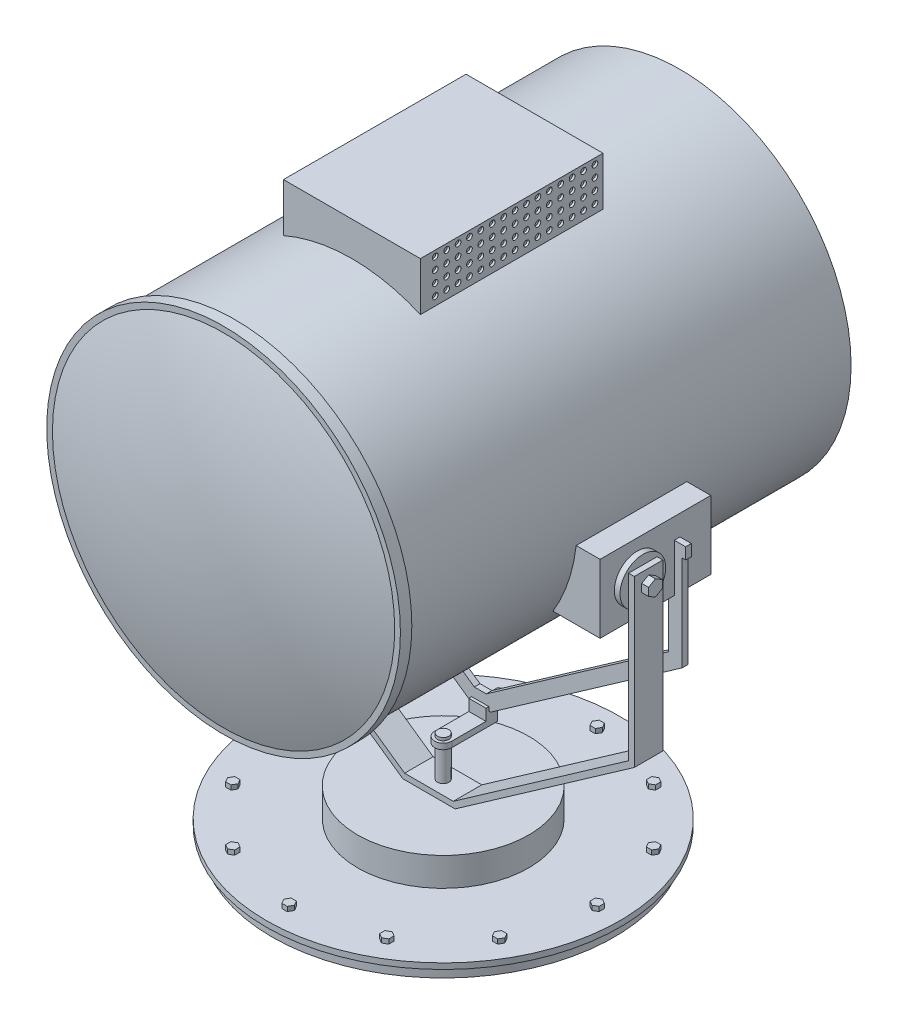
from build123d import *

# Parameters (mm, degrees)
SKETCH1_R                        = 150
BOSS_EXTRUDE1_DEPTH              = 10
SKETCH2_R                        = 155
BOSS_EXTRUDE2_DEPTH              = 5
SKETCH3_R                        = 75
BOSS_EXTRUDE3_DEPTH              = 25
BOSS_EXTRUDE4_DEPTH              = 12.5
SKETCH5_W                        = 5
SKETCH5_H                        = 25
BOSS_EXTRUDE5_DEPTH              = 80
SKETCH6_R                        = 150
BOSS_EXTRUDE6_DEPTH              = 207.5
SKETCH7_R                        = 150
CUT_EXTRUDE1_DEPTH               = 15
SKETCH9_R                        = 155
SKETCH9_R_2                      = 150
BOSS_EXTRUDE8_DEPTH              = 10
BOSS_EXTRUDE9_REACH              = 559.388
BOSS_EXTRUDE9_END_RADIUS         = 150
SKETCH10_W                       = 120
SKETCH10_H                       = 160
BOSS_EXTRUDE9_DIRECTION_2_DEPTH  = 25
SKETCH11_R                       = 20
BOSS_EXTRUDE10_DEPTH             = 5
BOSS_EXTRUDE11_REACH             = 654.423
BOSS_EXTRUDE11_END_RADIUS        = 150
SKETCH12_W                       = 65
SKETCH12_H                       = 60
BOSS_EXTRUDE12_REACH             = 435.222
BOSS_EXTRUDE12_END_RADIUS        = 150
SKETCH13_W                       = 80
SKETCH13_H                       = 240
BOSS_EXTRUDE12_DIRECTION_2_DEPTH = 8
SKETCH14_R                       = 2.5
CUT_EXTRUDE2_DEPTH               = 2
BOSS_EXTRUDE13_DEPTH             = 32
LPATTERN1_COUNT                  = 15
LPATTERN1_PITCH                  = 10
LPATTERN1_COUNT_DIR2             = 4
LPATTERN1_PITCH_DIR2             = 10
SKETCH16_R                       = 2.5
CUT_EXTRUDE3_DEPTH               = 5
LPATTERN2_COUNT                  = 23
LPATTERN2_PITCH                  = 10
MIRROR2_COPY_1_SKETCH_R          = 2.5
MIRROR2_COPY_1_DEPTH             = 2
MIRROR2_COPY_2_SKETCH_R          = 2.5
MIRROR2_COPY_2_DEPTH             = 2
MIRROR2_COPY_3_SKETCH_R          = 2.5
MIRROR2_COPY_3_DEPTH             = 2
MIRROR2_COPY_4_SKETCH_R          = 2.5
MIRROR2_COPY_4_DEPTH             = 2
MIRROR2_COPY_5_SKETCH_R          = 2.5
MIRROR2_COPY_5_DEPTH             = 2
MIRROR2_COPY_6_SKETCH_R          = 2.5
MIRROR2_COPY_6_DEPTH             = 2
MIRROR2_COPY_7_SKETCH_R          = 2.5
MIRROR2_COPY_7_DEPTH             = 2
MIRROR2_COPY_8_SKETCH_R          = 2.5
MIRROR2_COPY_8_DEPTH             = 2
MIRROR2_COPY_9_SKETCH_R          = 2.5
MIRROR2_COPY_9_DEPTH             = 2
MIRROR2_COPY_10_SKETCH_R         = 2.5
MIRROR2_COPY_10_DEPTH            = 2
MIRROR2_COPY_11_SKETCH_R         = 2.5
MIRROR2_COPY_11_DEPTH            = 2
MIRROR2_COPY_12_SKETCH_R         = 2.5
MIRROR2_COPY_12_DEPTH            = 2
MIRROR2_COPY_13_SKETCH_R         = 2.5
MIRROR2_COPY_13_DEPTH            = 2
MIRROR2_COPY_14_SKETCH_R         = 2.5
MIRROR2_COPY_14_DEPTH            = 2
MIRROR2_COPY_15_SKETCH_R         = 2.5
MIRROR2_COPY_15_DEPTH            = 2
MIRROR2_COPY_16_SKETCH_R         = 2.5
MIRROR2_COPY_16_DEPTH            = 2
MIRROR2_COPY_17_SKETCH_R         = 2.5
MIRROR2_COPY_17_DEPTH            = 2
MIRROR2_COPY_18_SKETCH_R         = 2.5
MIRROR2_COPY_18_DEPTH            = 2
MIRROR2_COPY_19_SKETCH_R         = 2.5
MIRROR2_COPY_19_DEPTH            = 2
MIRROR2_COPY_20_SKETCH_R         = 2.5
MIRROR2_COPY_20_DEPTH            = 2
MIRROR2_COPY_21_SKETCH_R         = 2.5
MIRROR2_COPY_21_DEPTH            = 2
MIRROR2_COPY_22_SKETCH_R         = 2.5
MIRROR2_COPY_22_DEPTH            = 2
MIRROR2_COPY_23_SKETCH_R         = 2.5
MIRROR2_COPY_23_DEPTH            = 2
MIRROR2_COPY_24_SKETCH_R         = 2.5
MIRROR2_COPY_24_DEPTH            = 2
MIRROR2_COPY_25_SKETCH_R         = 2.5
MIRROR2_COPY_25_DEPTH            = 2
MIRROR2_COPY_26_SKETCH_R         = 2.5
MIRROR2_COPY_26_DEPTH            = 2
MIRROR2_COPY_27_SKETCH_R         = 2.5
MIRROR2_COPY_27_DEPTH            = 2
MIRROR2_COPY_28_SKETCH_R         = 2.5
MIRROR2_COPY_28_DEPTH            = 2
MIRROR2_COPY_29_SKETCH_R         = 2.5
MIRROR2_COPY_29_DEPTH            = 2
MIRROR2_COPY_30_SKETCH_R         = 2.5
MIRROR2_COPY_30_DEPTH            = 2
MIRROR2_COPY_31_SKETCH_R         = 2.5
MIRROR2_COPY_31_DEPTH            = 2
MIRROR2_COPY_32_SKETCH_R         = 2.5
MIRROR2_COPY_32_DEPTH            = 2
MIRROR2_COPY_33_SKETCH_R         = 2.5
MIRROR2_COPY_33_DEPTH            = 2
MIRROR2_COPY_34_SKETCH_R         = 2.5
MIRROR2_COPY_34_DEPTH            = 2
MIRROR2_COPY_35_SKETCH_R         = 2.5
MIRROR2_COPY_35_DEPTH            = 2
MIRROR2_COPY_36_SKETCH_R         = 2.5
MIRROR2_COPY_36_DEPTH            = 2
MIRROR2_COPY_37_SKETCH_R         = 2.5
MIRROR2_COPY_37_DEPTH            = 2
MIRROR2_COPY_38_SKETCH_R         = 2.5
MIRROR2_COPY_38_DEPTH            = 2
MIRROR2_COPY_39_SKETCH_R         = 2.5
MIRROR2_COPY_39_DEPTH            = 2
MIRROR2_COPY_40_SKETCH_R         = 2.5
MIRROR2_COPY_40_DEPTH            = 2
MIRROR2_COPY_41_SKETCH_R         = 2.5
MIRROR2_COPY_41_DEPTH            = 2
MIRROR2_COPY_42_SKETCH_R         = 2.5
MIRROR2_COPY_42_DEPTH            = 2
MIRROR2_COPY_43_SKETCH_R         = 2.5
MIRROR2_COPY_43_DEPTH            = 2
MIRROR2_COPY_44_SKETCH_R         = 2.5
MIRROR2_COPY_44_DEPTH            = 2
MIRROR2_COPY_45_SKETCH_R         = 2.5
MIRROR2_COPY_45_DEPTH            = 2
MIRROR2_COPY_46_SKETCH_R         = 2.5
MIRROR2_COPY_46_DEPTH            = 2
MIRROR2_COPY_47_SKETCH_R         = 2.5
MIRROR2_COPY_47_DEPTH            = 2
MIRROR2_COPY_48_SKETCH_R         = 2.5
MIRROR2_COPY_48_DEPTH            = 2
MIRROR2_COPY_49_SKETCH_R         = 2.5
MIRROR2_COPY_49_DEPTH            = 2
MIRROR2_COPY_50_SKETCH_R         = 2.5
MIRROR2_COPY_50_DEPTH            = 2
MIRROR2_COPY_51_SKETCH_R         = 2.5
MIRROR2_COPY_51_DEPTH            = 2
MIRROR2_COPY_52_SKETCH_R         = 2.5
MIRROR2_COPY_52_DEPTH            = 2
MIRROR2_COPY_53_SKETCH_R         = 2.5
MIRROR2_COPY_53_DEPTH            = 2
MIRROR2_COPY_54_SKETCH_R         = 2.5
MIRROR2_COPY_54_DEPTH            = 2
MIRROR2_COPY_55_SKETCH_R         = 2.5
MIRROR2_COPY_55_DEPTH            = 2
MIRROR2_COPY_56_SKETCH_R         = 2.5
MIRROR2_COPY_56_DEPTH            = 2
MIRROR2_COPY_57_SKETCH_R         = 2.5
MIRROR2_COPY_57_DEPTH            = 2
MIRROR2_COPY_58_SKETCH_R         = 2.5
MIRROR2_COPY_58_DEPTH            = 2
MIRROR2_COPY_59_SKETCH_R         = 2.5
MIRROR2_COPY_59_DEPTH            = 2
MIRROR2_COPY_60_SKETCH_R         = 2.5
MIRROR2_COPY_60_DEPTH            = 5
MIRROR2_COPY_61_SKETCH_R         = 2.5
MIRROR2_COPY_61_DEPTH            = 5
MIRROR2_COPY_62_SKETCH_R         = 2.5
MIRROR2_COPY_62_DEPTH            = 5
MIRROR2_COPY_63_SKETCH_R         = 2.5
MIRROR2_COPY_63_DEPTH            = 5
MIRROR2_COPY_64_SKETCH_R         = 2.5
MIRROR2_COPY_64_DEPTH            = 5
MIRROR2_COPY_65_SKETCH_R         = 2.5
MIRROR2_COPY_65_DEPTH            = 5
MIRROR2_COPY_66_SKETCH_R         = 2.5
MIRROR2_COPY_66_DEPTH            = 5
MIRROR2_COPY_67_SKETCH_R         = 2.5
MIRROR2_COPY_67_DEPTH            = 5
MIRROR2_COPY_68_SKETCH_R         = 2.5
MIRROR2_COPY_68_DEPTH            = 5
MIRROR2_COPY_69_SKETCH_R         = 2.5
MIRROR2_COPY_69_DEPTH            = 5
MIRROR2_COPY_70_SKETCH_R         = 2.5
MIRROR2_COPY_70_DEPTH            = 5
MIRROR2_COPY_71_SKETCH_R         = 2.5
MIRROR2_COPY_71_DEPTH            = 5
MIRROR2_COPY_72_SKETCH_R         = 2.5
MIRROR2_COPY_72_DEPTH            = 5
MIRROR2_COPY_73_SKETCH_R         = 2.5
MIRROR2_COPY_73_DEPTH            = 5
MIRROR2_COPY_74_SKETCH_R         = 2.5
MIRROR2_COPY_74_DEPTH            = 5
MIRROR2_COPY_75_SKETCH_R         = 2.5
MIRROR2_COPY_75_DEPTH            = 5
MIRROR2_COPY_76_SKETCH_R         = 2.5
MIRROR2_COPY_76_DEPTH            = 5
MIRROR2_COPY_77_SKETCH_R         = 2.5
MIRROR2_COPY_77_DEPTH            = 5
MIRROR2_COPY_78_SKETCH_R         = 2.5
MIRROR2_COPY_78_DEPTH            = 5
MIRROR2_COPY_79_SKETCH_R         = 2.5
MIRROR2_COPY_79_DEPTH            = 5
MIRROR2_COPY_80_SKETCH_R         = 2.5
MIRROR2_COPY_80_DEPTH            = 5
MIRROR2_COPY_81_SKETCH_R         = 2.5
MIRROR2_COPY_81_DEPTH            = 5
SKETCH17_R                       = 5
BOSS_EXTRUDE14_DEPTH             = 35
SKETCH18_R                       = 7.5
SKETCH18_R_2                     = 5
BOSS_EXTRUDE15_DEPTH             = 2.5
BOSS_EXTRUDE16_DEPTH             = 2.5
SKETCH21_W                       = 15
SKETCH21_H                       = 5
BOSS_EXTRUDE18_DEPTH             = 15
SKETCH22_W                       = 15
SKETCH22_H                       = 10
BOSS_EXTRUDE19_DEPTH             = 10
EXTRUDE_THIN1_START              = -5
EXTRUDE_THIN1_DEPTH              = 5
BOSS_EXTRUDE20_DEPTH             = 4
CIRPATTERN2_COUNT                = 12
BOSS_EXTRUDE21_DEPTH             = 6


# Read off the part's stored shape, not the designer's step: Dome2, Extrude-Thin1
with BuildPart() as part:
    # Sketch1 → Boss-Extrude1 (new body)
    with BuildSketch(Plane(origin=(0, 0, 0), x_dir=(1, 0, 0), z_dir=(0, 1, 0))):
        with Locations(Location((0, 0, 0), (0, 0, 270))):
            Circle(SKETCH1_R)
    extrude(amount=BOSS_EXTRUDE1_DEPTH)


with BuildPart() as body_2:
    # Sketch2 → Boss-Extrude2 (new body)
    with BuildSketch(Plane(origin=(0, 10, 0), x_dir=(1, 0, 0), z_dir=(0, 1, 0))):
        with Locations(Location((0, 0, 0), (0, 0, 270))):
            Circle(SKETCH2_R)
    extrude(amount=BOSS_EXTRUDE2_DEPTH)

    # Sketch3 → Boss-Extrude3 (add)
    with BuildSketch(Plane(origin=(0, 15, 0), x_dir=(1, 0, 0), z_dir=(0, 1, 0))):
        with Locations(Location((0, 0, 0), (0, 0, 270))):
            Circle(SKETCH3_R)
    extrude(amount=BOSS_EXTRUDE3_DEPTH)

    # Sketch4 → Boss-Extrude4 (add, symmetric)
    with BuildSketch(Plane.XY):
        Polygon((-22.903719258, 40), (22.903719258, 40), (180, 150), (180, 215), (175, 215), (175, 152.602835253), (21.327225314, 45), (-21.327225314, 45), (-175, 152.602835253), (-175, 215), (-180, 215), (-180, 150), align=None)
    extrude(amount=BOSS_EXTRUDE4_DEPTH, both=True)

    # Sketch5 → Boss-Extrude5 (add)
    with BuildSketch(Plane(origin=(0, 215, 0), x_dir=(1, 0, 0), z_dir=(0, 1, 0))):
        with Locations((177.5, 0)):
            Rectangle(SKETCH5_W, SKETCH5_H)
    boss_extrude5 = extrude(amount=BOSS_EXTRUDE5_DEPTH)

    # Mirror1: Boss-Extrude5 across plane
    add(boss_extrude5.mirror(Plane(origin=(0, 0, 0), x_dir=(0, 0, 1), z_dir=(1, 0, 0))))

    # Sketch11 → Boss-Extrude10 (add)
    with BuildSketch(Plane(origin=(-175, 0, 0), x_dir=(0, 0, -1), z_dir=(1, 0, 0))):
        with Locations(Location((0, 283, 0), (0, 0, 231.317812547))):
            Circle(SKETCH11_R)
    boss_extrude10 = extrude(amount=BOSS_EXTRUDE10_DEPTH)

    # Boss-Extrude11: up to this cylinder (the profile starts outside it)
    boss_extrude11_end = Plane(origin=(0, 330, 0), z_dir=(0, 0, -1)) * Cylinder(BOSS_EXTRUDE11_END_RADIUS, 1609.846, mode=Mode.PRIVATE)
    # Sketch12 → Boss-Extrude11 (add, up to the surface)
    with BuildSketch(Plane(origin=(-170, 0, 0), x_dir=(0, 0, -1), z_dir=(1, 0, 0)), mode=Mode.PRIVATE) as boss_extrude11_sk1:
        with Locations((0, 283)):
            Rectangle(SKETCH12_W, SKETCH12_H)
    boss_extrude11_tool1 = extrude(boss_extrude11_sk1.sketch, amount=BOSS_EXTRUDE11_REACH, mode=Mode.PRIVATE) - boss_extrude11_end
    boss_extrude11 = boss_extrude11_tool1.solids().sort_by_distance((-170, 283, 0))[0]
    add(boss_extrude11)


with BuildPart() as body_3:
    # Sketch6 → Boss-Extrude6 (new, symmetric)
    with BuildSketch(Plane.XY):
        with Locations((0, 330)):
            Circle(SKETCH6_R)
    extrude(amount=BOSS_EXTRUDE6_DEPTH, both=True)

    # Sketch7 → Cut-Extrude1 (cut)
    with BuildSketch(Plane.XY.offset(207.5)):
        with Locations((0, 330)):
            Circle(SKETCH7_R)
    extrude(amount=-CUT_EXTRUDE1_DEPTH, mode=Mode.SUBTRACT)

    # Boss-Extrude9: up to this cylinder (the profile starts outside it)
    boss_extrude9_end = Plane(origin=(0, 330, 0), z_dir=(0, 0, -1)) * Cylinder(BOSS_EXTRUDE9_END_RADIUS, 1419.776, mode=Mode.PRIVATE)
    # Sketch10 → Boss-Extrude9 (add, up to the surface)
    with BuildSketch(Plane(origin=(0, 485, 0), x_dir=(1, 0, 0), z_dir=(0, 1, 0)), mode=Mode.PRIVATE) as boss_extrude9_sk1:
        Rectangle(SKETCH10_W, SKETCH10_H)
    boss_extrude9_tool1 = extrude(boss_extrude9_sk1.sketch, amount=-BOSS_EXTRUDE9_REACH, mode=Mode.PRIVATE) - boss_extrude9_end
    add(boss_extrude9_tool1.solids().sort_by_distance((0, 485, 0))[0])

    # Sketch10 → Boss-Extrude9 direction 2 (add)
    with BuildSketch(Plane(origin=(0, 485, 0), x_dir=(1, 0, 0), z_dir=(0, 1, 0))):
        Rectangle(SKETCH10_W, SKETCH10_H)
    extrude(amount=BOSS_EXTRUDE9_DIRECTION_2_DEPTH)


    add(body_2.part)  # Boss-Extrude12 merges body 2
    # Boss-Extrude12: up to this cylinder (the profile starts outside it)
    boss_extrude12_end = Plane(origin=(0, 330, 0), z_dir=(0, 0, -1)) * Cylinder(BOSS_EXTRUDE12_END_RADIUS, 1171.444, mode=Mode.PRIVATE)
    # Sketch13 → Boss-Extrude12 (add, up to the surface)
    with BuildSketch(Plane(origin=(0, 175, 0), x_dir=(1, 0, 0), z_dir=(0, 1, 0)), mode=Mode.PRIVATE) as boss_extrude12_sk1:
        Rectangle(SKETCH13_W, SKETCH13_H)
    boss_extrude12_tool1 = extrude(boss_extrude12_sk1.sketch, amount=BOSS_EXTRUDE12_REACH, mode=Mode.PRIVATE) - boss_extrude12_end
    add(boss_extrude12_tool1.solids().sort_by_distance((0, 175, 0))[0])

    # Sketch13 → Boss-Extrude12 direction 2 (add)
    with BuildSketch(Plane(origin=(0, 175, 0), x_dir=(1, 0, 0), z_dir=(0, 1, 0))):
        Rectangle(SKETCH13_W, SKETCH13_H)
    extrude(amount=-BOSS_EXTRUDE12_DIRECTION_2_DEPTH)

    # Dome2 outline → Dome2 (revolve)
    with BuildSketch(Plane.XZ.offset(-330)):
        with BuildLine():
            Line((0, 192.5), (150.000000284, 192.4999999))
            ThreePointArc((150.000000284, 192.4999999), (76.089986084, 211.703214502), (0, 218.166005515))
            Line((0, 218.166005515), (0, 192.5))
        make_face()
    revolve(axis=Axis((0, 330, 0), (0, 0, 1)))

    # Sketch14 → Cut-Extrude2 (cut)
    with BuildSketch(Plane.ZY.offset(60)):
        with Locations((-73, 505)):
            Circle(SKETCH14_R)
    cut_extrude2 = extrude(amount=-CUT_EXTRUDE2_DEPTH, mode=Mode.SUBTRACT)

    # Sketch15 → Boss-Extrude13 (add)
    with BuildSketch(Plane(origin=(0, 0, -32.5), x_dir=(-1, 0, 0), z_dir=(0, 0, -1))):
        with BuildLine():
            Line((128.728396246, 253), (170, 253))
            Line((170, 253), (170, 313))
            Line((170, 313), (149.033553269, 313))
            ThreePointArc((149.033553269, 313), (142.08421851, 281.915960544), (128.728396246, 253))
        make_face()
    boss_extrude13 = extrude(amount=BOSS_EXTRUDE13_DEPTH)

    # LPattern1: Cut-Extrude2 15 × 4
    with Locations(*[(0, -j * LPATTERN1_PITCH_DIR2, i * LPATTERN1_PITCH) for i in range(LPATTERN1_COUNT) for j in range(LPATTERN1_COUNT_DIR2) if (i, j) != (0, 0)]):
        add(cut_extrude2, mode=Mode.SUBTRACT)

    # Sketch16 → Cut-Extrude3 (cut)
    with BuildSketch(Plane.ZY.offset(40)):
        with Locations((-115, 180.431677052)):
            Circle(SKETCH16_R)
        with Locations((-115, 172)):
            Circle(SKETCH16_R)
    cut_extrude3 = extrude(amount=-CUT_EXTRUDE3_DEPTH, mode=Mode.SUBTRACT)

    # LPattern2: Cut-Extrude3 ×23
    with Locations(*[(0, 0, i * LPATTERN2_PITCH) for i in range(1, LPATTERN2_COUNT)]):
        add(cut_extrude3, mode=Mode.SUBTRACT)

    # Mirror2: Boss-Extrude10, Boss-Extrude11, Cut-Extrude2, Boss-Extrude13, Cut-Extrude3 across plane
    add(boss_extrude10.mirror(Plane(origin=(0, 0, 0), x_dir=(0, 0, 1), z_dir=(1, 0, 0))))
    add(boss_extrude11.mirror(Plane(origin=(0, 0, 0), x_dir=(0, 0, 1), z_dir=(1, 0, 0))))
    add(cut_extrude2.mirror(Plane(origin=(0, 0, 0), x_dir=(0, 0, 1), z_dir=(1, 0, 0))), mode=Mode.SUBTRACT)
    add(boss_extrude13.mirror(Plane(origin=(0, 0, 0), x_dir=(0, 0, 1), z_dir=(1, 0, 0))))
    add(cut_extrude3.mirror(Plane(origin=(0, 0, 0), x_dir=(0, 0, 1), z_dir=(1, 0, 0))), mode=Mode.SUBTRACT)

    # Mirror2 copy 1 sketch → Mirror2 copy 1 (cut)
    with BuildSketch(Plane(origin=(60, -10, 0), x_dir=(0, 0, 1), z_dir=(1, 0, 0))):
        with Locations((-73, -505)):
            Circle(MIRROR2_COPY_1_SKETCH_R)
    extrude(amount=-MIRROR2_COPY_1_DEPTH, mode=Mode.SUBTRACT)

    # Mirror2 copy 2 sketch → Mirror2 copy 2 (cut)
    with BuildSketch(Plane(origin=(60, -20, 0), x_dir=(0, 0, 1), z_dir=(1, 0, 0))):
        with Locations((-73, -505)):
            Circle(MIRROR2_COPY_2_SKETCH_R)
    extrude(amount=-MIRROR2_COPY_2_DEPTH, mode=Mode.SUBTRACT)

    # Mirror2 copy 3 sketch → Mirror2 copy 3 (cut)
    with BuildSketch(Plane(origin=(60, -30, 0), x_dir=(0, 0, 1), z_dir=(1, 0, 0))):
        with Locations((-73, -505)):
            Circle(MIRROR2_COPY_3_SKETCH_R)
    extrude(amount=-MIRROR2_COPY_3_DEPTH, mode=Mode.SUBTRACT)

    # Mirror2 copy 4 sketch → Mirror2 copy 4 (cut)
    with BuildSketch(Plane(origin=(60, 0, 10), x_dir=(0, 0, 1), z_dir=(1, 0, 0))):
        with Locations((-73, -505)):
            Circle(MIRROR2_COPY_4_SKETCH_R)
    extrude(amount=-MIRROR2_COPY_4_DEPTH, mode=Mode.SUBTRACT)

    # Mirror2 copy 5 sketch → Mirror2 copy 5 (cut)
    with BuildSketch(Plane(origin=(60, -10, 10), x_dir=(0, 0, 1), z_dir=(1, 0, 0))):
        with Locations((-73, -505)):
            Circle(MIRROR2_COPY_5_SKETCH_R)
    extrude(amount=-MIRROR2_COPY_5_DEPTH, mode=Mode.SUBTRACT)

    # Mirror2 copy 6 sketch → Mirror2 copy 6 (cut)
    with BuildSketch(Plane(origin=(60, -20, 10), x_dir=(0, 0, 1), z_dir=(1, 0, 0))):
        with Locations((-73, -505)):
            Circle(MIRROR2_COPY_6_SKETCH_R)
    extrude(amount=-MIRROR2_COPY_6_DEPTH, mode=Mode.SUBTRACT)

    # Mirror2 copy 7 sketch → Mirror2 copy 7 (cut)
    with BuildSketch(Plane(origin=(60, -30, 10), x_dir=(0, 0, 1), z_dir=(1, 0, 0))):
        with Locations((-73, -505)):
            Circle(MIRROR2_COPY_7_SKETCH_R)
    extrude(amount=-MIRROR2_COPY_7_DEPTH, mode=Mode.SUBTRACT)

    # Mirror2 copy 8 sketch → Mirror2 copy 8 (cut)
    with BuildSketch(Plane(origin=(60, 0, 20), x_dir=(0, 0, 1), z_dir=(1, 0, 0))):
        with Locations((-73, -505)):
            Circle(MIRROR2_COPY_8_SKETCH_R)
    extrude(amount=-MIRROR2_COPY_8_DEPTH, mode=Mode.SUBTRACT)

    # Mirror2 copy 9 sketch → Mirror2 copy 9 (cut)
    with BuildSketch(Plane(origin=(60, -10, 20), x_dir=(0, 0, 1), z_dir=(1, 0, 0))):
        with Locations((-73, -505)):
            Circle(MIRROR2_COPY_9_SKETCH_R)
    extrude(amount=-MIRROR2_COPY_9_DEPTH, mode=Mode.SUBTRACT)

    # Mirror2 copy 10 sketch → Mirror2 copy 10 (cut)
    with BuildSketch(Plane(origin=(60, -20, 20), x_dir=(0, 0, 1), z_dir=(1, 0, 0))):
        with Locations((-73, -505)):
            Circle(MIRROR2_COPY_10_SKETCH_R)
    extrude(amount=-MIRROR2_COPY_10_DEPTH, mode=Mode.SUBTRACT)

    # Mirror2 copy 11 sketch → Mirror2 copy 11 (cut)
    with BuildSketch(Plane(origin=(60, -30, 20), x_dir=(0, 0, 1), z_dir=(1, 0, 0))):
        with Locations((-73, -505)):
            Circle(MIRROR2_COPY_11_SKETCH_R)
    extrude(amount=-MIRROR2_COPY_11_DEPTH, mode=Mode.SUBTRACT)

    # Mirror2 copy 12 sketch → Mirror2 copy 12 (cut)
    with BuildSketch(Plane(origin=(60, 0, 30), x_dir=(0, 0, 1), z_dir=(1, 0, 0))):
        with Locations((-73, -505)):
            Circle(MIRROR2_COPY_12_SKETCH_R)
    extrude(amount=-MIRROR2_COPY_12_DEPTH, mode=Mode.SUBTRACT)

    # Mirror2 copy 13 sketch → Mirror2 copy 13 (cut)
    with BuildSketch(Plane(origin=(60, -10, 30), x_dir=(0, 0, 1), z_dir=(1, 0, 0))):
        with Locations((-73, -505)):
            Circle(MIRROR2_COPY_13_SKETCH_R)
    extrude(amount=-MIRROR2_COPY_13_DEPTH, mode=Mode.SUBTRACT)

    # Mirror2 copy 14 sketch → Mirror2 copy 14 (cut)
    with BuildSketch(Plane(origin=(60, -20, 30), x_dir=(0, 0, 1), z_dir=(1, 0, 0))):
        with Locations((-73, -505)):
            Circle(MIRROR2_COPY_14_SKETCH_R)
    extrude(amount=-MIRROR2_COPY_14_DEPTH, mode=Mode.SUBTRACT)

    # Mirror2 copy 15 sketch → Mirror2 copy 15 (cut)
    with BuildSketch(Plane(origin=(60, -30, 30), x_dir=(0, 0, 1), z_dir=(1, 0, 0))):
        with Locations((-73, -505)):
            Circle(MIRROR2_COPY_15_SKETCH_R)
    extrude(amount=-MIRROR2_COPY_15_DEPTH, mode=Mode.SUBTRACT)

    # Mirror2 copy 16 sketch → Mirror2 copy 16 (cut)
    with BuildSketch(Plane(origin=(60, 0, 40), x_dir=(0, 0, 1), z_dir=(1, 0, 0))):
        with Locations((-73, -505)):
            Circle(MIRROR2_COPY_16_SKETCH_R)
    extrude(amount=-MIRROR2_COPY_16_DEPTH, mode=Mode.SUBTRACT)

    # Mirror2 copy 17 sketch → Mirror2 copy 17 (cut)
    with BuildSketch(Plane(origin=(60, -10, 40), x_dir=(0, 0, 1), z_dir=(1, 0, 0))):
        with Locations((-73, -505)):
            Circle(MIRROR2_COPY_17_SKETCH_R)
    extrude(amount=-MIRROR2_COPY_17_DEPTH, mode=Mode.SUBTRACT)

    # Mirror2 copy 18 sketch → Mirror2 copy 18 (cut)
    with BuildSketch(Plane(origin=(60, -20, 40), x_dir=(0, 0, 1), z_dir=(1, 0, 0))):
        with Locations((-73, -505)):
            Circle(MIRROR2_COPY_18_SKETCH_R)
    extrude(amount=-MIRROR2_COPY_18_DEPTH, mode=Mode.SUBTRACT)

    # Mirror2 copy 19 sketch → Mirror2 copy 19 (cut)
    with BuildSketch(Plane(origin=(60, -30, 40), x_dir=(0, 0, 1), z_dir=(1, 0, 0))):
        with Locations((-73, -505)):
            Circle(MIRROR2_COPY_19_SKETCH_R)
    extrude(amount=-MIRROR2_COPY_19_DEPTH, mode=Mode.SUBTRACT)

    # Mirror2 copy 20 sketch → Mirror2 copy 20 (cut)
    with BuildSketch(Plane(origin=(60, 0, 50), x_dir=(0, 0, 1), z_dir=(1, 0, 0))):
        with Locations((-73, -505)):
            Circle(MIRROR2_COPY_20_SKETCH_R)
    extrude(amount=-MIRROR2_COPY_20_DEPTH, mode=Mode.SUBTRACT)

    # Mirror2 copy 21 sketch → Mirror2 copy 21 (cut)
    with BuildSketch(Plane(origin=(60, -10, 50), x_dir=(0, 0, 1), z_dir=(1, 0, 0))):
        with Locations((-73, -505)):
            Circle(MIRROR2_COPY_21_SKETCH_R)
    extrude(amount=-MIRROR2_COPY_21_DEPTH, mode=Mode.SUBTRACT)

    # Mirror2 copy 22 sketch → Mirror2 copy 22 (cut)
    with BuildSketch(Plane(origin=(60, -20, 50), x_dir=(0, 0, 1), z_dir=(1, 0, 0))):
        with Locations((-73, -505)):
            Circle(MIRROR2_COPY_22_SKETCH_R)
    extrude(amount=-MIRROR2_COPY_22_DEPTH, mode=Mode.SUBTRACT)

    # Mirror2 copy 23 sketch → Mirror2 copy 23 (cut)
    with BuildSketch(Plane(origin=(60, -30, 50), x_dir=(0, 0, 1), z_dir=(1, 0, 0))):
        with Locations((-73, -505)):
            Circle(MIRROR2_COPY_23_SKETCH_R)
    extrude(amount=-MIRROR2_COPY_23_DEPTH, mode=Mode.SUBTRACT)

    # Mirror2 copy 24 sketch → Mirror2 copy 24 (cut)
    with BuildSketch(Plane(origin=(60, 0, 60), x_dir=(0, 0, 1), z_dir=(1, 0, 0))):
        with Locations((-73, -505)):
            Circle(MIRROR2_COPY_24_SKETCH_R)
    extrude(amount=-MIRROR2_COPY_24_DEPTH, mode=Mode.SUBTRACT)

    # Mirror2 copy 25 sketch → Mirror2 copy 25 (cut)
    with BuildSketch(Plane(origin=(60, -10, 60), x_dir=(0, 0, 1), z_dir=(1, 0, 0))):
        with Locations((-73, -505)):
            Circle(MIRROR2_COPY_25_SKETCH_R)
    extrude(amount=-MIRROR2_COPY_25_DEPTH, mode=Mode.SUBTRACT)

    # Mirror2 copy 26 sketch → Mirror2 copy 26 (cut)
    with BuildSketch(Plane(origin=(60, -20, 60), x_dir=(0, 0, 1), z_dir=(1, 0, 0))):
        with Locations((-73, -505)):
            Circle(MIRROR2_COPY_26_SKETCH_R)
    extrude(amount=-MIRROR2_COPY_26_DEPTH, mode=Mode.SUBTRACT)

    # Mirror2 copy 27 sketch → Mirror2 copy 27 (cut)
    with BuildSketch(Plane(origin=(60, -30, 60), x_dir=(0, 0, 1), z_dir=(1, 0, 0))):
        with Locations((-73, -505)):
            Circle(MIRROR2_COPY_27_SKETCH_R)
    extrude(amount=-MIRROR2_COPY_27_DEPTH, mode=Mode.SUBTRACT)

    # Mirror2 copy 28 sketch → Mirror2 copy 28 (cut)
    with BuildSketch(Plane(origin=(60, 0, 70), x_dir=(0, 0, 1), z_dir=(1, 0, 0))):
        with Locations((-73, -505)):
            Circle(MIRROR2_COPY_28_SKETCH_R)
    extrude(amount=-MIRROR2_COPY_28_DEPTH, mode=Mode.SUBTRACT)

    # Mirror2 copy 29 sketch → Mirror2 copy 29 (cut)
    with BuildSketch(Plane(origin=(60, -10, 70), x_dir=(0, 0, 1), z_dir=(1, 0, 0))):
        with Locations((-73, -505)):
            Circle(MIRROR2_COPY_29_SKETCH_R)
    extrude(amount=-MIRROR2_COPY_29_DEPTH, mode=Mode.SUBTRACT)

    # Mirror2 copy 30 sketch → Mirror2 copy 30 (cut)
    with BuildSketch(Plane(origin=(60, -20, 70), x_dir=(0, 0, 1), z_dir=(1, 0, 0))):
        with Locations((-73, -505)):
            Circle(MIRROR2_COPY_30_SKETCH_R)
    extrude(amount=-MIRROR2_COPY_30_DEPTH, mode=Mode.SUBTRACT)

    # Mirror2 copy 31 sketch → Mirror2 copy 31 (cut)
    with BuildSketch(Plane(origin=(60, -30, 70), x_dir=(0, 0, 1), z_dir=(1, 0, 0))):
        with Locations((-73, -505)):
            Circle(MIRROR2_COPY_31_SKETCH_R)
    extrude(amount=-MIRROR2_COPY_31_DEPTH, mode=Mode.SUBTRACT)

    # Mirror2 copy 32 sketch → Mirror2 copy 32 (cut)
    with BuildSketch(Plane(origin=(60, 0, 80), x_dir=(0, 0, 1), z_dir=(1, 0, 0))):
        with Locations((-73, -505)):
            Circle(MIRROR2_COPY_32_SKETCH_R)
    extrude(amount=-MIRROR2_COPY_32_DEPTH, mode=Mode.SUBTRACT)

    # Mirror2 copy 33 sketch → Mirror2 copy 33 (cut)
    with BuildSketch(Plane(origin=(60, -10, 80), x_dir=(0, 0, 1), z_dir=(1, 0, 0))):
        with Locations((-73, -505)):
            Circle(MIRROR2_COPY_33_SKETCH_R)
    extrude(amount=-MIRROR2_COPY_33_DEPTH, mode=Mode.SUBTRACT)

    # Mirror2 copy 34 sketch → Mirror2 copy 34 (cut)
    with BuildSketch(Plane(origin=(60, -20, 80), x_dir=(0, 0, 1), z_dir=(1, 0, 0))):
        with Locations((-73, -505)):
            Circle(MIRROR2_COPY_34_SKETCH_R)
    extrude(amount=-MIRROR2_COPY_34_DEPTH, mode=Mode.SUBTRACT)

    # Mirror2 copy 35 sketch → Mirror2 copy 35 (cut)
    with BuildSketch(Plane(origin=(60, -30, 80), x_dir=(0, 0, 1), z_dir=(1, 0, 0))):
        with Locations((-73, -505)):
            Circle(MIRROR2_COPY_35_SKETCH_R)
    extrude(amount=-MIRROR2_COPY_35_DEPTH, mode=Mode.SUBTRACT)

    # Mirror2 copy 36 sketch → Mirror2 copy 36 (cut)
    with BuildSketch(Plane(origin=(60, 0, 90), x_dir=(0, 0, 1), z_dir=(1, 0, 0))):
        with Locations((-73, -505)):
            Circle(MIRROR2_COPY_36_SKETCH_R)
    extrude(amount=-MIRROR2_COPY_36_DEPTH, mode=Mode.SUBTRACT)

    # Mirror2 copy 37 sketch → Mirror2 copy 37 (cut)
    with BuildSketch(Plane(origin=(60, -10, 90), x_dir=(0, 0, 1), z_dir=(1, 0, 0))):
        with Locations((-73, -505)):
            Circle(MIRROR2_COPY_37_SKETCH_R)
    extrude(amount=-MIRROR2_COPY_37_DEPTH, mode=Mode.SUBTRACT)

    # Mirror2 copy 38 sketch → Mirror2 copy 38 (cut)
    with BuildSketch(Plane(origin=(60, -20, 90), x_dir=(0, 0, 1), z_dir=(1, 0, 0))):
        with Locations((-73, -505)):
            Circle(MIRROR2_COPY_38_SKETCH_R)
    extrude(amount=-MIRROR2_COPY_38_DEPTH, mode=Mode.SUBTRACT)

    # Mirror2 copy 39 sketch → Mirror2 copy 39 (cut)
    with BuildSketch(Plane(origin=(60, -30, 90), x_dir=(0, 0, 1), z_dir=(1, 0, 0))):
        with Locations((-73, -505)):
            Circle(MIRROR2_COPY_39_SKETCH_R)
    extrude(amount=-MIRROR2_COPY_39_DEPTH, mode=Mode.SUBTRACT)

    # Mirror2 copy 40 sketch → Mirror2 copy 40 (cut)
    with BuildSketch(Plane(origin=(60, 0, 100), x_dir=(0, 0, 1), z_dir=(1, 0, 0))):
        with Locations((-73, -505)):
            Circle(MIRROR2_COPY_40_SKETCH_R)
    extrude(amount=-MIRROR2_COPY_40_DEPTH, mode=Mode.SUBTRACT)

    # Mirror2 copy 41 sketch → Mirror2 copy 41 (cut)
    with BuildSketch(Plane(origin=(60, -10, 100), x_dir=(0, 0, 1), z_dir=(1, 0, 0))):
        with Locations((-73, -505)):
            Circle(MIRROR2_COPY_41_SKETCH_R)
    extrude(amount=-MIRROR2_COPY_41_DEPTH, mode=Mode.SUBTRACT)

    # Mirror2 copy 42 sketch → Mirror2 copy 42 (cut)
    with BuildSketch(Plane(origin=(60, -20, 100), x_dir=(0, 0, 1), z_dir=(1, 0, 0))):
        with Locations((-73, -505)):
            Circle(MIRROR2_COPY_42_SKETCH_R)
    extrude(amount=-MIRROR2_COPY_42_DEPTH, mode=Mode.SUBTRACT)

    # Mirror2 copy 43 sketch → Mirror2 copy 43 (cut)
    with BuildSketch(Plane(origin=(60, -30, 100), x_dir=(0, 0, 1), z_dir=(1, 0, 0))):
        with Locations((-73, -505)):
            Circle(MIRROR2_COPY_43_SKETCH_R)
    extrude(amount=-MIRROR2_COPY_43_DEPTH, mode=Mode.SUBTRACT)

    # Mirror2 copy 44 sketch → Mirror2 copy 44 (cut)
    with BuildSketch(Plane(origin=(60, 0, 110), x_dir=(0, 0, 1), z_dir=(1, 0, 0))):
        with Locations((-73, -505)):
            Circle(MIRROR2_COPY_44_SKETCH_R)
    extrude(amount=-MIRROR2_COPY_44_DEPTH, mode=Mode.SUBTRACT)

    # Mirror2 copy 45 sketch → Mirror2 copy 45 (cut)
    with BuildSketch(Plane(origin=(60, -10, 110), x_dir=(0, 0, 1), z_dir=(1, 0, 0))):
        with Locations((-73, -505)):
            Circle(MIRROR2_COPY_45_SKETCH_R)
    extrude(amount=-MIRROR2_COPY_45_DEPTH, mode=Mode.SUBTRACT)

    # Mirror2 copy 46 sketch → Mirror2 copy 46 (cut)
    with BuildSketch(Plane(origin=(60, -20, 110), x_dir=(0, 0, 1), z_dir=(1, 0, 0))):
        with Locations((-73, -505)):
            Circle(MIRROR2_COPY_46_SKETCH_R)
    extrude(amount=-MIRROR2_COPY_46_DEPTH, mode=Mode.SUBTRACT)

    # Mirror2 copy 47 sketch → Mirror2 copy 47 (cut)
    with BuildSketch(Plane(origin=(60, -30, 110), x_dir=(0, 0, 1), z_dir=(1, 0, 0))):
        with Locations((-73, -505)):
            Circle(MIRROR2_COPY_47_SKETCH_R)
    extrude(amount=-MIRROR2_COPY_47_DEPTH, mode=Mode.SUBTRACT)

    # Mirror2 copy 48 sketch → Mirror2 copy 48 (cut)
    with BuildSketch(Plane(origin=(60, 0, 120), x_dir=(0, 0, 1), z_dir=(1, 0, 0))):
        with Locations((-73, -505)):
            Circle(MIRROR2_COPY_48_SKETCH_R)
    extrude(amount=-MIRROR2_COPY_48_DEPTH, mode=Mode.SUBTRACT)

    # Mirror2 copy 49 sketch → Mirror2 copy 49 (cut)
    with BuildSketch(Plane(origin=(60, -10, 120), x_dir=(0, 0, 1), z_dir=(1, 0, 0))):
        with Locations((-73, -505)):
            Circle(MIRROR2_COPY_49_SKETCH_R)
    extrude(amount=-MIRROR2_COPY_49_DEPTH, mode=Mode.SUBTRACT)

    # Mirror2 copy 50 sketch → Mirror2 copy 50 (cut)
    with BuildSketch(Plane(origin=(60, -20, 120), x_dir=(0, 0, 1), z_dir=(1, 0, 0))):
        with Locations((-73, -505)):
            Circle(MIRROR2_COPY_50_SKETCH_R)
    extrude(amount=-MIRROR2_COPY_50_DEPTH, mode=Mode.SUBTRACT)

    # Mirror2 copy 51 sketch → Mirror2 copy 51 (cut)
    with BuildSketch(Plane(origin=(60, -30, 120), x_dir=(0, 0, 1), z_dir=(1, 0, 0))):
        with Locations((-73, -505)):
            Circle(MIRROR2_COPY_51_SKETCH_R)
    extrude(amount=-MIRROR2_COPY_51_DEPTH, mode=Mode.SUBTRACT)

    # Mirror2 copy 52 sketch → Mirror2 copy 52 (cut)
    with BuildSketch(Plane(origin=(60, 0, 130), x_dir=(0, 0, 1), z_dir=(1, 0, 0))):
        with Locations((-73, -505)):
            Circle(MIRROR2_COPY_52_SKETCH_R)
    extrude(amount=-MIRROR2_COPY_52_DEPTH, mode=Mode.SUBTRACT)

    # Mirror2 copy 53 sketch → Mirror2 copy 53 (cut)
    with BuildSketch(Plane(origin=(60, -10, 130), x_dir=(0, 0, 1), z_dir=(1, 0, 0))):
        with Locations((-73, -505)):
            Circle(MIRROR2_COPY_53_SKETCH_R)
    extrude(amount=-MIRROR2_COPY_53_DEPTH, mode=Mode.SUBTRACT)

    # Mirror2 copy 54 sketch → Mirror2 copy 54 (cut)
    with BuildSketch(Plane(origin=(60, -20, 130), x_dir=(0, 0, 1), z_dir=(1, 0, 0))):
        with Locations((-73, -505)):
            Circle(MIRROR2_COPY_54_SKETCH_R)
    extrude(amount=-MIRROR2_COPY_54_DEPTH, mode=Mode.SUBTRACT)

    # Mirror2 copy 55 sketch → Mirror2 copy 55 (cut)
    with BuildSketch(Plane(origin=(60, -30, 130), x_dir=(0, 0, 1), z_dir=(1, 0, 0))):
        with Locations((-73, -505)):
            Circle(MIRROR2_COPY_55_SKETCH_R)
    extrude(amount=-MIRROR2_COPY_55_DEPTH, mode=Mode.SUBTRACT)

    # Mirror2 copy 56 sketch → Mirror2 copy 56 (cut)
    with BuildSketch(Plane(origin=(60, 0, 140), x_dir=(0, 0, 1), z_dir=(1, 0, 0))):
        with Locations((-73, -505)):
            Circle(MIRROR2_COPY_56_SKETCH_R)
    extrude(amount=-MIRROR2_COPY_56_DEPTH, mode=Mode.SUBTRACT)

    # Mirror2 copy 57 sketch → Mirror2 copy 57 (cut)
    with BuildSketch(Plane(origin=(60, -10, 140), x_dir=(0, 0, 1), z_dir=(1, 0, 0))):
        with Locations((-73, -505)):
            Circle(MIRROR2_COPY_57_SKETCH_R)
    extrude(amount=-MIRROR2_COPY_57_DEPTH, mode=Mode.SUBTRACT)

    # Mirror2 copy 58 sketch → Mirror2 copy 58 (cut)
    with BuildSketch(Plane(origin=(60, -20, 140), x_dir=(0, 0, 1), z_dir=(1, 0, 0))):
        with Locations((-73, -505)):
            Circle(MIRROR2_COPY_58_SKETCH_R)
    extrude(amount=-MIRROR2_COPY_58_DEPTH, mode=Mode.SUBTRACT)

    # Mirror2 copy 59 sketch → Mirror2 copy 59 (cut)
    with BuildSketch(Plane(origin=(60, -30, 140), x_dir=(0, 0, 1), z_dir=(1, 0, 0))):
        with Locations((-73, -505)):
            Circle(MIRROR2_COPY_59_SKETCH_R)
    extrude(amount=-MIRROR2_COPY_59_DEPTH, mode=Mode.SUBTRACT)

    # Mirror2 copy 60 sketch → Mirror2 copy 60 (cut)
    with BuildSketch(Plane(origin=(40, 0, 10), x_dir=(0, 0, 1), z_dir=(1, 0, 0))):
        with Locations((-115, -180.431677052)):
            Circle(MIRROR2_COPY_60_SKETCH_R)
        with Locations((-115, -172)):
            Circle(MIRROR2_COPY_60_SKETCH_R)
    extrude(amount=-MIRROR2_COPY_60_DEPTH, mode=Mode.SUBTRACT)

    # Mirror2 copy 61 sketch → Mirror2 copy 61 (cut)
    with BuildSketch(Plane(origin=(40, 0, 20), x_dir=(0, 0, 1), z_dir=(1, 0, 0))):
        with Locations((-115, -180.431677052)):
            Circle(MIRROR2_COPY_61_SKETCH_R)
        with Locations((-115, -172)):
            Circle(MIRROR2_COPY_61_SKETCH_R)
    extrude(amount=-MIRROR2_COPY_61_DEPTH, mode=Mode.SUBTRACT)

    # Mirror2 copy 62 sketch → Mirror2 copy 62 (cut)
    with BuildSketch(Plane(origin=(40, 0, 30), x_dir=(0, 0, 1), z_dir=(1, 0, 0))):
        with Locations((-115, -180.431677052)):
            Circle(MIRROR2_COPY_62_SKETCH_R)
        with Locations((-115, -172)):
            Circle(MIRROR2_COPY_62_SKETCH_R)
    extrude(amount=-MIRROR2_COPY_62_DEPTH, mode=Mode.SUBTRACT)

    # Mirror2 copy 63 sketch → Mirror2 copy 63 (cut)
    with BuildSketch(Plane(origin=(40, 0, 40), x_dir=(0, 0, 1), z_dir=(1, 0, 0))):
        with Locations((-115, -180.431677052)):
            Circle(MIRROR2_COPY_63_SKETCH_R)
        with Locations((-115, -172)):
            Circle(MIRROR2_COPY_63_SKETCH_R)
    extrude(amount=-MIRROR2_COPY_63_DEPTH, mode=Mode.SUBTRACT)

    # Mirror2 copy 64 sketch → Mirror2 copy 64 (cut)
    with BuildSketch(Plane(origin=(40, 0, 50), x_dir=(0, 0, 1), z_dir=(1, 0, 0))):
        with Locations((-115, -180.431677052)):
            Circle(MIRROR2_COPY_64_SKETCH_R)
        with Locations((-115, -172)):
            Circle(MIRROR2_COPY_64_SKETCH_R)
    extrude(amount=-MIRROR2_COPY_64_DEPTH, mode=Mode.SUBTRACT)

    # Mirror2 copy 65 sketch → Mirror2 copy 65 (cut)
    with BuildSketch(Plane(origin=(40, 0, 60), x_dir=(0, 0, 1), z_dir=(1, 0, 0))):
        with Locations((-115, -180.431677052)):
            Circle(MIRROR2_COPY_65_SKETCH_R)
        with Locations((-115, -172)):
            Circle(MIRROR2_COPY_65_SKETCH_R)
    extrude(amount=-MIRROR2_COPY_65_DEPTH, mode=Mode.SUBTRACT)

    # Mirror2 copy 66 sketch → Mirror2 copy 66 (cut)
    with BuildSketch(Plane(origin=(40, 0, 70), x_dir=(0, 0, 1), z_dir=(1, 0, 0))):
        with Locations((-115, -180.431677052)):
            Circle(MIRROR2_COPY_66_SKETCH_R)
        with Locations((-115, -172)):
            Circle(MIRROR2_COPY_66_SKETCH_R)
    extrude(amount=-MIRROR2_COPY_66_DEPTH, mode=Mode.SUBTRACT)

    # Mirror2 copy 67 sketch → Mirror2 copy 67 (cut)
    with BuildSketch(Plane(origin=(40, 0, 80), x_dir=(0, 0, 1), z_dir=(1, 0, 0))):
        with Locations((-115, -180.431677052)):
            Circle(MIRROR2_COPY_67_SKETCH_R)
        with Locations((-115, -172)):
            Circle(MIRROR2_COPY_67_SKETCH_R)
    extrude(amount=-MIRROR2_COPY_67_DEPTH, mode=Mode.SUBTRACT)

    # Mirror2 copy 68 sketch → Mirror2 copy 68 (cut)
    with BuildSketch(Plane(origin=(40, 0, 90), x_dir=(0, 0, 1), z_dir=(1, 0, 0))):
        with Locations((-115, -180.431677052)):
            Circle(MIRROR2_COPY_68_SKETCH_R)
        with Locations((-115, -172)):
            Circle(MIRROR2_COPY_68_SKETCH_R)
    extrude(amount=-MIRROR2_COPY_68_DEPTH, mode=Mode.SUBTRACT)

    # Mirror2 copy 69 sketch → Mirror2 copy 69 (cut)
    with BuildSketch(Plane(origin=(40, 0, 100), x_dir=(0, 0, 1), z_dir=(1, 0, 0))):
        with Locations((-115, -180.431677052)):
            Circle(MIRROR2_COPY_69_SKETCH_R)
        with Locations((-115, -172)):
            Circle(MIRROR2_COPY_69_SKETCH_R)
    extrude(amount=-MIRROR2_COPY_69_DEPTH, mode=Mode.SUBTRACT)

    # Mirror2 copy 70 sketch → Mirror2 copy 70 (cut)
    with BuildSketch(Plane(origin=(40, 0, 110), x_dir=(0, 0, 1), z_dir=(1, 0, 0))):
        with Locations((-115, -180.431677052)):
            Circle(MIRROR2_COPY_70_SKETCH_R)
        with Locations((-115, -172)):
            Circle(MIRROR2_COPY_70_SKETCH_R)
    extrude(amount=-MIRROR2_COPY_70_DEPTH, mode=Mode.SUBTRACT)

    # Mirror2 copy 71 sketch → Mirror2 copy 71 (cut)
    with BuildSketch(Plane(origin=(40, 0, 120), x_dir=(0, 0, 1), z_dir=(1, 0, 0))):
        with Locations((-115, -180.431677052)):
            Circle(MIRROR2_COPY_71_SKETCH_R)
        with Locations((-115, -172)):
            Circle(MIRROR2_COPY_71_SKETCH_R)
    extrude(amount=-MIRROR2_COPY_71_DEPTH, mode=Mode.SUBTRACT)

    # Mirror2 copy 72 sketch → Mirror2 copy 72 (cut)
    with BuildSketch(Plane(origin=(40, 0, 130), x_dir=(0, 0, 1), z_dir=(1, 0, 0))):
        with Locations((-115, -180.431677052)):
            Circle(MIRROR2_COPY_72_SKETCH_R)
        with Locations((-115, -172)):
            Circle(MIRROR2_COPY_72_SKETCH_R)
    extrude(amount=-MIRROR2_COPY_72_DEPTH, mode=Mode.SUBTRACT)

    # Mirror2 copy 73 sketch → Mirror2 copy 73 (cut)
    with BuildSketch(Plane(origin=(40, 0, 140), x_dir=(0, 0, 1), z_dir=(1, 0, 0))):
        with Locations((-115, -180.431677052)):
            Circle(MIRROR2_COPY_73_SKETCH_R)
        with Locations((-115, -172)):
            Circle(MIRROR2_COPY_73_SKETCH_R)
    extrude(amount=-MIRROR2_COPY_73_DEPTH, mode=Mode.SUBTRACT)

    # Mirror2 copy 74 sketch → Mirror2 copy 74 (cut)
    with BuildSketch(Plane(origin=(40, 0, 150), x_dir=(0, 0, 1), z_dir=(1, 0, 0))):
        with Locations((-115, -180.431677052)):
            Circle(MIRROR2_COPY_74_SKETCH_R)
        with Locations((-115, -172)):
            Circle(MIRROR2_COPY_74_SKETCH_R)
    extrude(amount=-MIRROR2_COPY_74_DEPTH, mode=Mode.SUBTRACT)

    # Mirror2 copy 75 sketch → Mirror2 copy 75 (cut)
    with BuildSketch(Plane(origin=(40, 0, 160), x_dir=(0, 0, 1), z_dir=(1, 0, 0))):
        with Locations((-115, -180.431677052)):
            Circle(MIRROR2_COPY_75_SKETCH_R)
        with Locations((-115, -172)):
            Circle(MIRROR2_COPY_75_SKETCH_R)
    extrude(amount=-MIRROR2_COPY_75_DEPTH, mode=Mode.SUBTRACT)

    # Mirror2 copy 76 sketch → Mirror2 copy 76 (cut)
    with BuildSketch(Plane(origin=(40, 0, 170), x_dir=(0, 0, 1), z_dir=(1, 0, 0))):
        with Locations((-115, -180.431677052)):
            Circle(MIRROR2_COPY_76_SKETCH_R)
        with Locations((-115, -172)):
            Circle(MIRROR2_COPY_76_SKETCH_R)
    extrude(amount=-MIRROR2_COPY_76_DEPTH, mode=Mode.SUBTRACT)

    # Mirror2 copy 77 sketch → Mirror2 copy 77 (cut)
    with BuildSketch(Plane(origin=(40, 0, 180), x_dir=(0, 0, 1), z_dir=(1, 0, 0))):
        with Locations((-115, -180.431677052)):
            Circle(MIRROR2_COPY_77_SKETCH_R)
        with Locations((-115, -172)):
            Circle(MIRROR2_COPY_77_SKETCH_R)
    extrude(amount=-MIRROR2_COPY_77_DEPTH, mode=Mode.SUBTRACT)

    # Mirror2 copy 78 sketch → Mirror2 copy 78 (cut)
    with BuildSketch(Plane(origin=(40, 0, 190), x_dir=(0, 0, 1), z_dir=(1, 0, 0))):
        with Locations((-115, -180.431677052)):
            Circle(MIRROR2_COPY_78_SKETCH_R)
        with Locations((-115, -172)):
            Circle(MIRROR2_COPY_78_SKETCH_R)
    extrude(amount=-MIRROR2_COPY_78_DEPTH, mode=Mode.SUBTRACT)

    # Mirror2 copy 79 sketch → Mirror2 copy 79 (cut)
    with BuildSketch(Plane(origin=(40, 0, 200), x_dir=(0, 0, 1), z_dir=(1, 0, 0))):
        with Locations((-115, -180.431677052)):
            Circle(MIRROR2_COPY_79_SKETCH_R)
        with Locations((-115, -172)):
            Circle(MIRROR2_COPY_79_SKETCH_R)
    extrude(amount=-MIRROR2_COPY_79_DEPTH, mode=Mode.SUBTRACT)

    # Mirror2 copy 80 sketch → Mirror2 copy 80 (cut)
    with BuildSketch(Plane(origin=(40, 0, 210), x_dir=(0, 0, 1), z_dir=(1, 0, 0))):
        with Locations((-115, -180.431677052)):
            Circle(MIRROR2_COPY_80_SKETCH_R)
        with Locations((-115, -172)):
            Circle(MIRROR2_COPY_80_SKETCH_R)
    extrude(amount=-MIRROR2_COPY_80_DEPTH, mode=Mode.SUBTRACT)

    # Mirror2 copy 81 sketch → Mirror2 copy 81 (cut)
    with BuildSketch(Plane(origin=(40, 0, 220), x_dir=(0, 0, 1), z_dir=(1, 0, 0))):
        with Locations((-115, -180.431677052)):
            Circle(MIRROR2_COPY_81_SKETCH_R)
        with Locations((-115, -172)):
            Circle(MIRROR2_COPY_81_SKETCH_R)
    extrude(amount=-MIRROR2_COPY_81_DEPTH, mode=Mode.SUBTRACT)

    # Sketch17 → Boss-Extrude14 (add)
    with BuildSketch(Plane(origin=(0, 45, 0), x_dir=(1, 0, 0), z_dir=(0, 1, 0))):
        with Locations(Location((0, 0, 0), (0, 0, 90))):
            Circle(SKETCH17_R)
    extrude(amount=BOSS_EXTRUDE14_DEPTH)



with BuildPart() as body_4:
    # Sketch9 → Boss-Extrude8 (new body)
    with BuildSketch(Plane.XY.offset(192.5)):
        with Locations((0, 330)):
            Circle(SKETCH9_R)
        with Locations((0, 330)):
            Circle(SKETCH9_R_2, mode=Mode.SUBTRACT)
    extrude(amount=-BOSS_EXTRUDE8_DEPTH)


with BuildPart() as body_4_2:
    # Sketch18 → Boss-Extrude15 (new, symmetric)
    with BuildSketch(Plane(origin=(0, 75, 0), x_dir=(1, 0, 0), z_dir=(0, 1, 0))):
        with Locations(Location((0, 0, 0), (0, 0, 270))):
            Circle(SKETCH18_R)
        with Locations(Location((0, 0, 0), (0, 0, 90))):
            Circle(SKETCH18_R_2, mode=Mode.SUBTRACT)
    extrude(amount=BOSS_EXTRUDE15_DEPTH, both=True)


with BuildPart() as body_3_1:
    add(body_3.part)

    add(body_4_2.part)  # Boss-Extrude16 merges body 4 2
    # Sketch19 → Boss-Extrude16 (add, symmetric)
    with BuildSketch(Plane(origin=(0, 75, 0), x_dir=(1, 0, 0), z_dir=(0, 1, 0))):
        with BuildLine():
            Line((7.5, 0), (7.5, 25))
            Line((7.5, 25), (-7.5, 25))
            Line((-7.5, 25), (-7.5, 0))
            ThreePointArc((-7.5, 0), (0, 7.5), (7.5, 0))
        make_face()
    extrude(amount=BOSS_EXTRUDE16_DEPTH, both=True)

    # Sketch21 → Boss-Extrude18 (add)
    with BuildSketch(Plane(origin=(0, 0, -25), x_dir=(-1, 0, 0), z_dir=(0, 0, -1))):
        with Locations((0, 75)):
            Rectangle(SKETCH21_W, SKETCH21_H)
    extrude(amount=BOSS_EXTRUDE18_DEPTH)

    # Sketch22 → Boss-Extrude19 (add)
    with BuildSketch(Plane(origin=(0, 77.5, 0), x_dir=(1, 0, 0), z_dir=(0, 1, 0))):
        with Locations((0, 35)):
            Rectangle(SKETCH22_W, SKETCH22_H)
    extrude(amount=BOSS_EXTRUDE19_DEPTH)

    # Extrude-Thin1 outline → Extrude-Thin1 (add)
    with BuildSketch(Plane(origin=(0, 0, -37.5), x_dir=(-1, 0, 0), z_dir=(0, 0, -1)).offset(EXTRUDE_THIN1_START)):
        Polygon((-180, 295), (-180, 285), (-177, 285), (-177, 201.613459291), (-9.030572548, 84), (-7.5, 84), (-7.5, 87.5), (7.5, 87.5), (7.5, 84), (9.030572548, 84), (177, 201.613459291), (177, 285), (180, 285), (180, 295), (170, 295), (170, 253), (165, 253), (165, 207.860263897), (5.246987081, 96), (-5.246987081, 96), (-165, 207.860263897), (-165, 253), (-170, 253), (-170, 295), align=None)
    extrude(amount=EXTRUDE_THIN1_DEPTH)

    # Sketch25 → Boss-Extrude20 (add)
    with BuildSketch(Plane(origin=(0, 15, 0), x_dir=(1, 0, 0), z_dir=(0, 1, 0))):
        Polygon((-135, 4.618802154), (-139, 2.309401077), (-139, -2.309401077), (-135, -4.618802154), (-131, -2.309401077), (-131, 2.309401077), align=None)
    boss_extrude20 = extrude(amount=BOSS_EXTRUDE20_DEPTH)

    # CirPattern2: Boss-Extrude20 ×12 about axis
    cirpattern2_axis = Axis((0, 0, 0), (0, 1, 0))
    for i in range(1, CIRPATTERN2_COUNT):
        add(boss_extrude20.rotate(cirpattern2_axis, i * 360 / CIRPATTERN2_COUNT))

    # Sketch26 → Boss-Extrude21 (add)
    with BuildSketch(Plane(origin=(180, 0, 0), x_dir=(0, 0, -1), z_dir=(1, 0, 0))):
        Polygon((0, 289.92820323), (-6, 286.464101615), (-6, 279.535898385), (0, 276.07179677), (6, 279.535898385), (6, 286.464101615), align=None)
    boss_extrude21 = extrude(amount=BOSS_EXTRUDE21_DEPTH)

    # Mirror3: Boss-Extrude21 across plane
    add(boss_extrude21.mirror(Plane(origin=(0, 0, 0), x_dir=(0, 0, 1), z_dir=(1, 0, 0))))


solid = Compound([part.part, body_4.part, body_3_1.part])
